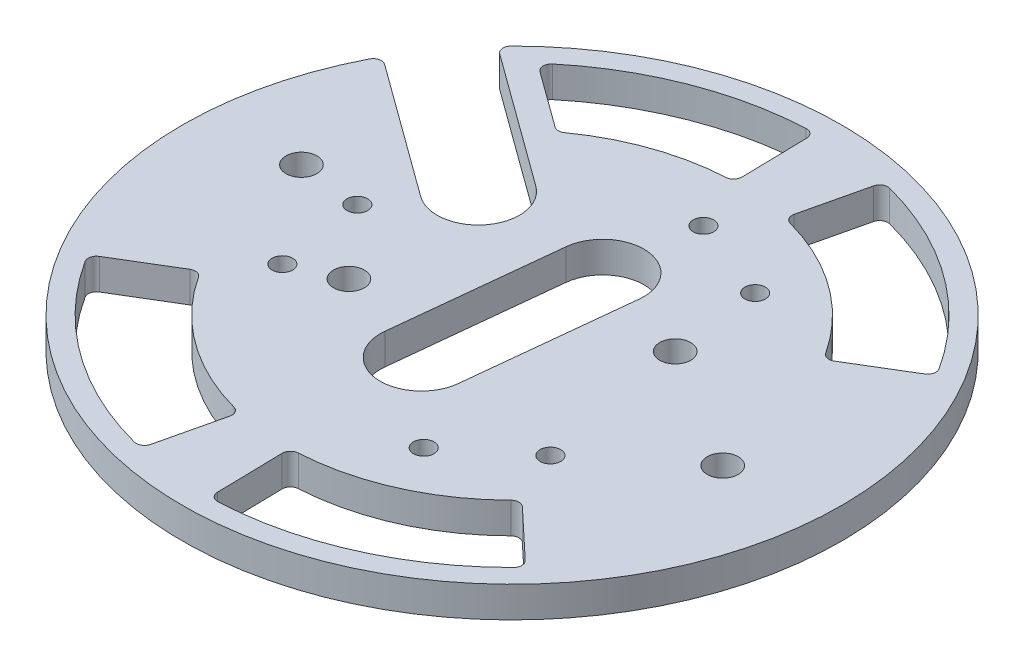
from build123d import *

# Parameters (mm, degrees)
SKETCH1_R              = 101.6
BOSS_EXTRUDE1_DEPTH    = 9.525
SKETCH2_R              = 4.7625
SKETCH2_R_2            = 3.175
CUT_EXTRUDE1_DEPTH     = 22.86
CUT_EXTRUDE2_START     = -9.525
CUT_EXTRUDE2_OUTLINE_R = 4.7625
CUT_EXTRUDE2_DEPTH     = 9.525
FILLET1_R              = 2.54
FILLET3_R              = 2.54


# Read off the part's stored shape, not the designer's step: Cut-Extrude2
with BuildPart() as part:
    # Sketch1 → Boss-Extrude1 (new body)
    with BuildSketch(Plane(origin=(0, 0, 0), x_dir=(1, 0, 0), z_dir=(0, 1, 0))):
        with Locations(Location((0, 0, 0), (0, 0, 90))):
            Circle(SKETCH1_R)
    extrude(amount=BOSS_EXTRUDE1_DEPTH)

    # Sketch2 → Cut-Extrude1 (cut)
    with BuildSketch(Plane(origin=(0, 9.525, 0), x_dir=(1, 0, 0), z_dir=(0, 1, 0))):
        with BuildLine():
            Line((-9.955759688, 26.595729902), (-15.303128109, -23.922045692))
            ThreePointArc((-15.303128109, -23.922045692), (-4.010526316, -37.888331696), (9.955759688, -26.595729902))
            Line((9.955759688, -26.595729902), (15.303128109, 23.922045692))
            ThreePointArc((15.303128109, 23.922045692), (4.010526316, 37.888331696), (-9.955759688, 26.595729902))
        make_face()
        with Locations(Location((34.817520913, 15.470948176, 0), (0, 0, 270))):
            Circle(SKETCH2_R)
        with Locations(Location((-34.817520913, -15.470948176, 0), (0, 0, 270))):
            Circle(SKETCH2_R)
        with BuildLine():
            Line((-30.765292524, 38.093536125), (-87.237043764, 79.186441231))
            Line((-87.237043764, 79.186441231), (-104.485964967, 60.325))
            Line((-104.485964967, 60.325), (-45.710214871, 17.555539727))
            ThreePointArc((-45.710214871, 17.555539727), (-27.968755498, 20.352076753), (-30.765292524, 38.093536125))
        make_face()
        with Locations(Location((5.646300897, 53.341856998, 0), (0, 0, 270))):
            Circle(SKETCH2_R_2)
        with Locations(Location((31.560768513, 43.372252797, 0), (0, 0, 270))):
            Circle(SKETCH2_R_2)
        with Locations(Location((-53.341856998, 5.646300897, 0), (0, 0, 270))):
            Circle(SKETCH2_R_2)
        with Locations(Location((43.372252797, -31.560768513, 0), (0, 0, 270))):
            Circle(SKETCH2_R_2)
        with Locations(Location((-49.018553694, -21.781088485, 0), (0, 0, 270))):
            Circle(SKETCH2_R_2)
        with Locations(Location((21.781088485, -49.018553694, 0), (0, 0, 270))):
            Circle(SKETCH2_R_2)
    extrude(amount=-CUT_EXTRUDE1_DEPTH, mode=Mode.SUBTRACT)

    # Cut-Extrude2 outline → Cut-Extrude2 (cut)
    with BuildSketch(Plane(origin=(0, 9.525, 0), x_dir=(1, 0, 0), z_dir=(0, 1, 0)).offset(CUT_EXTRUDE2_START)):
        with Locations((-72.619302416, 7.686842105)):
            Circle(CUT_EXTRUDE2_OUTLINE_R)
        with Locations((72.619302416, -7.686842105)):
            Circle(CUT_EXTRUDE2_OUTLINE_R)
        with BuildLine():
            Line((-21.78993702, -92.72411307), (-15.979287148, -67.997682918))
            ThreePointArc((-15.979287148, -67.997682918), (-41.099184753, -56.47901834), (-59.78603337, -36.119976659))
            Line((-59.78603337, -36.119976659), (-81.526409141, -49.254513627))
            ThreePointArc((-81.526409141, -49.254513627), (-56.044342845, -77.016843191), (-21.78993702, -92.72411307))
        make_face()
        with BuildLine():
            Line((1.387800686, -69.83621202), (1.892455481, -95.231198209))
            ThreePointArc((1.892455481, -95.231198209), (38.6763713, -87.044246238), (69.406468953, -65.232695541))
            Line((69.406468953, -65.232695541), (50.898077232, -47.837310063))
            ThreePointArc((50.898077232, -47.837310063), (28.362672287, -63.832447241), (1.387800686, -69.83621202))
        make_face()
        with BuildLine():
            Line((59.78603337, 36.119976659), (81.526409141, 49.254513627))
            ThreePointArc((81.526409141, 49.254513627), (56.044342845, 77.016843191), (21.78993702, 92.72411307))
            Line((21.78993702, 92.72411307), (15.979287148, 67.997682918))
            ThreePointArc((15.979287148, 67.997682918), (41.099184753, 56.47901834), (59.78603337, 36.119976659))
        make_face()
        with BuildLine():
            Line((-1.387800686, 69.83621202), (-1.892455481, 95.231198209))
            ThreePointArc((-1.892455481, 95.231198209), (-34.737758173, 88.689631058), (-63.288565419, 71.183705911))
            Line((-63.288565419, 71.183705911), (-42.080853774, 55.751450615))
            ThreePointArc((-42.080853774, 55.751450615), (-22.846796408, 66.00792675), (-1.387800686, 69.83621202))
        make_face()
    extrude(amount=CUT_EXTRUDE2_DEPTH, mode=Mode.SUBTRACT)

    # Fillet1
    fillet1_edges = [part.edges().sort_by_distance(p)[0] for p in [
        (-74.035185173, 4.7625, -69.579820037),
        (-88.980107519, 4.7625, -49.041823639),
    ]]
    fillet(fillet1_edges, radius=FILLET1_R)

    # Fillet3
    fillet3_edges = [part.edges().sort_by_distance(p)[0] for p in [
        (-15.979287148, 4.7625, 67.997682918),
        (-21.78993702, 4.7625, 92.72411307),
        (-81.526409141, 4.7625, 49.254513627),
        (-59.78603337, 4.7625, 36.119976659),
        (50.898077232, 4.7625, 47.837310063),
        (69.406468953, 4.7625, 65.232695541),
        (1.892455481, 4.7625, 95.231198209),
        (1.387800686, 4.7625, 69.83621202),
        (15.979287148, 4.7625, -67.997682918),
        (21.78993702, 4.7625, -92.72411307),
        (81.526409141, 4.7625, -49.254513627),
        (59.78603337, 4.7625, -36.119976659),
        (-42.080853774, 4.7625, -55.751450615),
        (-63.288565419, 4.7625, -71.183705911),
        (-1.892455481, 4.7625, -95.231198209),
        (-1.387800686, 4.7625, -69.83621202),
    ]]
    fillet(fillet3_edges, radius=FILLET3_R)


solid = part.part
